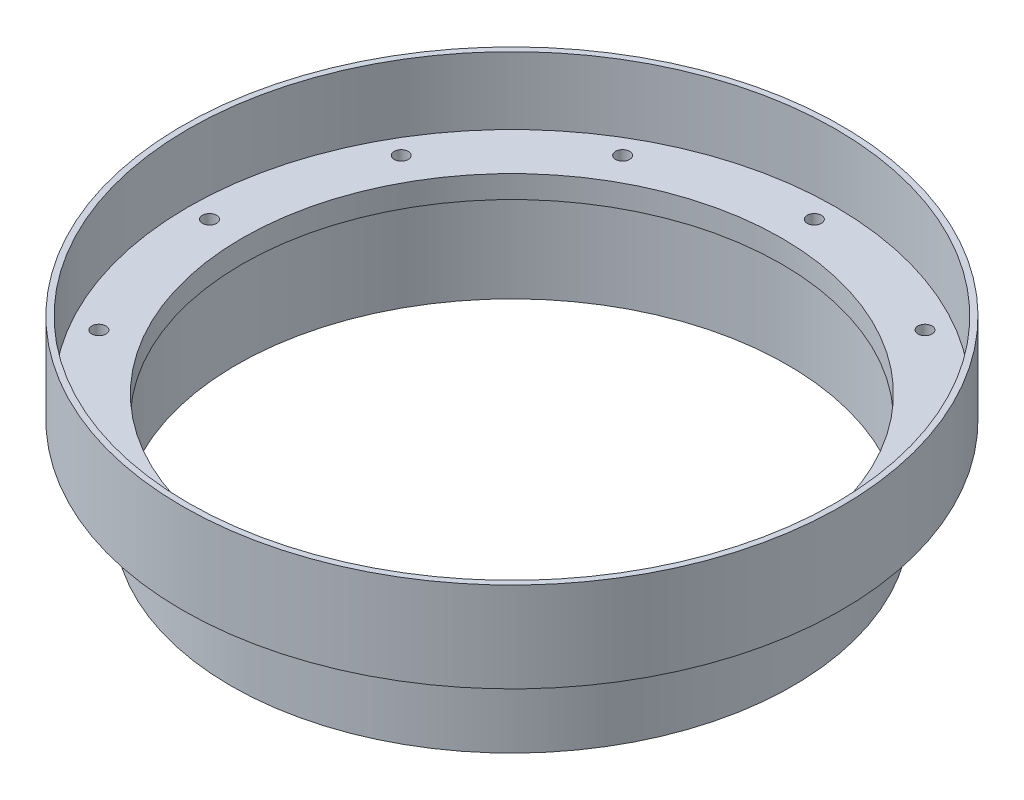
from build123d import *

# Parameters (mm, degrees)
SCREW_HOLES_COUNT = 12


with BuildPart() as part:
    # Cross Section → Main (revolve)
    with BuildSketch(Plane.XY):
        Polygon((-38.1, 0), (-38.1, -3.175), (-38.8874, -3.175), (-38.8874, -15.875), (-39.68115, -15.875), (-39.68115, -3.175), (-46.53915, -3.175), (-46.53915, 9.525), (-45.72, 9.525), (-45.72, 0), align=None)
    revolve(axis=Axis((0, 55, 0), (0, -1, 0)))

    # Sketch7 → #3-48 Tapped Hole1 (revolve, cut)
    with BuildSketch(Plane(origin=(-42.700575, 0, 0), x_dir=(0, 0, 1), z_dir=(1, 0, 0))):
        Polygon((0, 0), (0, 3.901027994), (0.99695, 3.302), (0.99695, 0), align=None)
    f_3_48_tapped_hole1 = revolve(axis=Axis((-42.700575, 6.35, 0), (0, -1, 0)), mode=Mode.SUBTRACT)

    # Screw Holes: #3-48 Tapped Hole1 ×12 about axis
    screw_holes_axis = Axis((0, 55, 0), (0, -1, 0))
    for i in range(1, SCREW_HOLES_COUNT):
        add(f_3_48_tapped_hole1.rotate(screw_holes_axis, i * 360 / SCREW_HOLES_COUNT), mode=Mode.SUBTRACT)


solid = part.part
